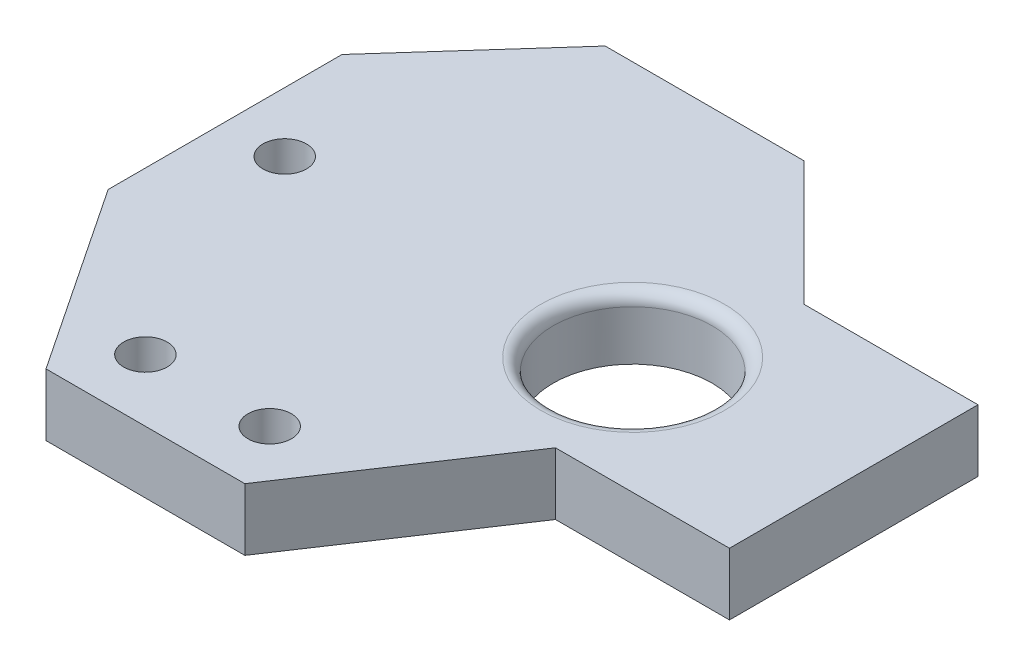
from build123d import *

# Parameters (mm, degrees)
SKETCH1_R           = 1.75
BOSS_EXTRUDE1_DEPTH = 5
SKETCH2_R           = 1.75
SKETCH2_R_2         = 6.4
CUT_EXTRUDE1_DEPTH  = 10
FILLET1_R           = 1


with BuildPart() as part:
    # Sketch1 → Boss-Extrude1 (new body)
    with BuildSketch(Plane(origin=(0, 0, 0), x_dir=(1, 0, 0), z_dir=(0, 1, 0))):
        Polygon((10, 45), (0, 33.819660113), (0, 15), (10, 0), (26, 0), (36, 15), (50, 15), (50, 35), (36, 35), (26, 45), align=None)
        with Locations((13, 5)):
            Circle(SKETCH1_R, mode=Mode.SUBTRACT)
        with Locations((23, 5)):
            Circle(SKETCH1_R, mode=Mode.SUBTRACT)
    extrude(amount=BOSS_EXTRUDE1_DEPTH)

    # Sketch2 → Cut-Extrude1 (cut)
    with BuildSketch(Plane(origin=(0, 0, 0), x_dir=(-1, 0, 0), z_dir=(0, -1, 0))):
        with Locations((-4.8, 24.409830056)):
            Circle(SKETCH2_R)
        with Locations((-32.8, 24.409830056)):
            Circle(SKETCH2_R_2)
    extrude(amount=-CUT_EXTRUDE1_DEPTH, mode=Mode.SUBTRACT)

    # Fillet1
    fillet1_edges = [part.edges().sort_by_distance(p)[0] for p in [
        (39.2, 5, -24.409830056),
    ]]
    fillet(fillet1_edges, radius=FILLET1_R)


solid = part.part
